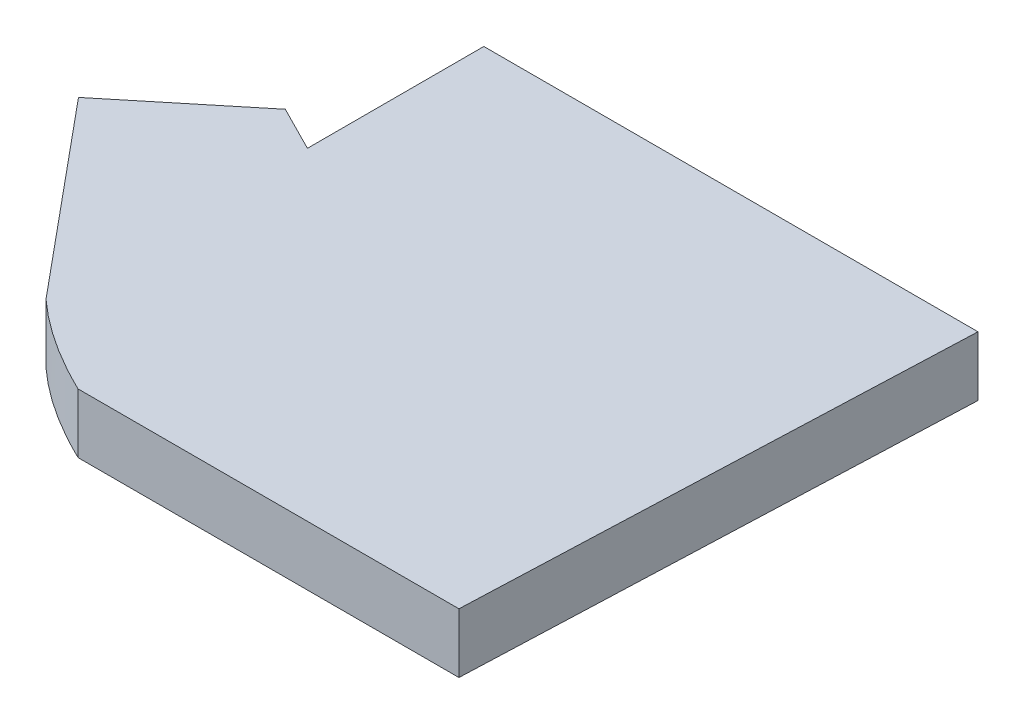
from build123d import *

# Parameters (mm, degrees)
BOSS_EXTRUDE1_DEPTH      = 5
BOSS_EXTRUDE1_DEPTH_BACK = 5


with BuildPart() as part:
    # Sketch1 → Boss-Extrude1 (new, two sides: drawn at the far end of the back side and taken through both)
    with BuildSketch(Plane(origin=(0, 0, 0), x_dir=(1, 0, 0), z_dir=(0, 1, 0)).offset(-BOSS_EXTRUDE1_DEPTH_BACK)):
        with BuildLine():
            Line((-13.928487002, -6.6), (69.071512998, -6.6))
            Line((69.071512998, -6.6), (65.775815813, -90.485447194))
            Line((65.775815813, -90.485447194), (1.805682841, -90.485447194))
            add(Edge.make_bspline(
                [(-13.928487002, -80.137896099), (-7.522602167, -85.991642169), (1.805682841, -90.485447194)],
                knots=[0, 0, 0, 1, 1, 1], degree=2))
            Line((-13.928487002, -80.137896099), (-40.559490947, -48.052901374))
            Line((-40.559490947, -48.052901374), (-21.468692729, -32.405513879))
            Line((-21.468692729, -32.405513879), (-13.928487002, -36.229878556))
            Line((-13.928487002, -36.229878556), (-13.928487002, -6.6))
        make_face()
    extrude(amount=BOSS_EXTRUDE1_DEPTH + BOSS_EXTRUDE1_DEPTH_BACK)


solid = part.part
